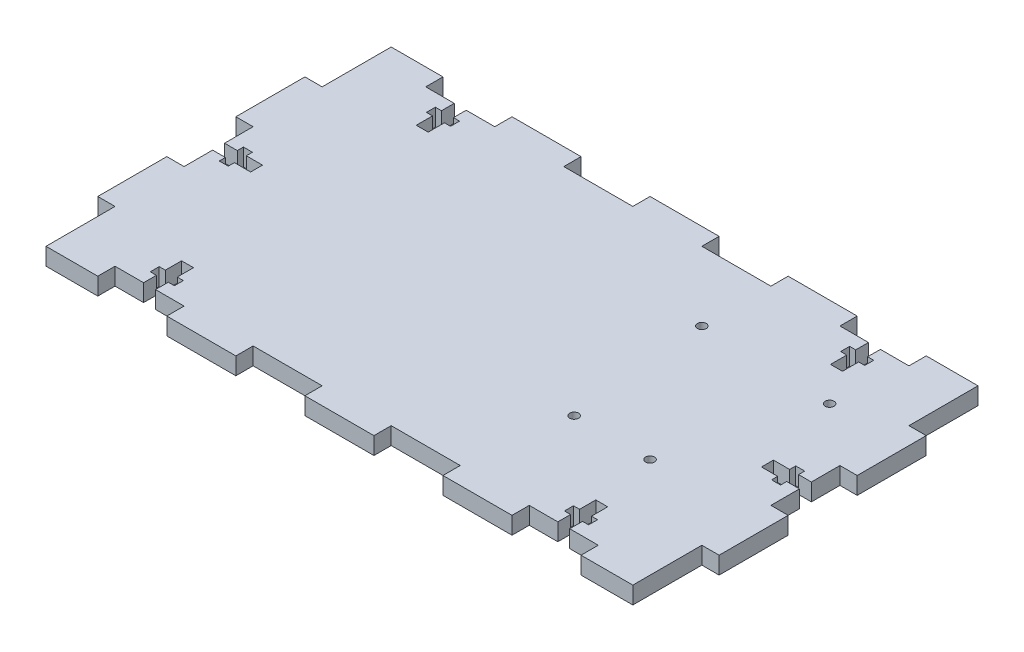
from build123d import *

# Parameters (mm, degrees)
SKETCH1_W                 = 228.6
SKETCH1_H                 = 127
BOSS_EXTRUDE1_DEPTH       = 6.35
SKETCH2_W                 = 6.35
SKETCH2_H                 = 25.4
CUT_EXTRUDE1_DEPTH        = 6.35
LPATTERN1_COUNT           = 3
LPATTERN1_PITCH           = 50.8
LPATTERN1_COUNT_DIR2      = 2
LPATTERN1_PITCH_DIR2      = 222.25
SKETCH3_W                 = 25.4
SKETCH3_H                 = 6.35
CUT_EXTRUDE2_DEPTH        = 6.35
LPATTERN2_COUNT           = 4
LPATTERN2_PITCH           = 50.8
LPATTERN2_COUNT_DIR2      = 2
LPATTERN2_PITCH_DIR2      = 120.65
SKETCH4_W                 = 13.97
SKETCH4_H                 = 4.3942
SKETCH4_W_2               = 3.302
SKETCH4_H_2               = 8.89
CUT_EXTRUDE3_DEPTH        = 8.89
SKETCH5_W                 = 4.3942
SKETCH5_H                 = 13.97
SKETCH5_W_2               = 8.89
SKETCH5_H_2               = 3.302
CUT_EXTRUDE4_DEPTH        = 30.48
MIRROR3_COPY_1_SKETCH_W   = 4.3942
MIRROR3_COPY_1_SKETCH_H   = 13.97
MIRROR3_COPY_1_SKETCH_W_2 = 8.89
MIRROR3_COPY_1_SKETCH_H_2 = 3.302
MIRROR3_COPY_1_DEPTH      = 30.48
MIRROR3_COPY_2_SKETCH_W   = 4.3942
MIRROR3_COPY_2_SKETCH_H   = 13.97
MIRROR3_COPY_2_SKETCH_W_2 = 8.89
MIRROR3_COPY_2_SKETCH_H_2 = 3.302
MIRROR3_COPY_2_DEPTH      = 30.48
F_4_CLEARANCE_HOLE1_D     = 3.2639
F_4_CLEARANCE_HOLE1_DEPTH = 10.16
F_4_CLEARANCE_HOLE1_TIP   = 0.980574487


with BuildPart() as part:
    # Sketch1 → Boss-Extrude1 (new body)
    with BuildSketch(Plane(origin=(0, 0, 0), x_dir=(1, 0, 0), z_dir=(0, 1, 0))):
        with Locations((114.3, 63.5)):
            Rectangle(SKETCH1_W, SKETCH1_H)
    extrude(amount=BOSS_EXTRUDE1_DEPTH)

    # Sketch2 → Cut-Extrude1 (cut)
    with BuildSketch(Plane(origin=(0, 6.35, 0), x_dir=(1, 0, 0), z_dir=(0, 1, 0))):
        with Locations((3.175, 114.3)):
            Rectangle(SKETCH2_W, SKETCH2_H)
    cut_extrude1 = extrude(amount=-CUT_EXTRUDE1_DEPTH, mode=Mode.SUBTRACT)

    # LPattern1: Cut-Extrude1 3 × 2
    with Locations(*[(j * LPATTERN1_PITCH_DIR2, 0, i * LPATTERN1_PITCH) for i in range(LPATTERN1_COUNT) for j in range(LPATTERN1_COUNT_DIR2) if (i, j) != (0, 0)]):
        add(cut_extrude1, mode=Mode.SUBTRACT)

    # Sketch3 → Cut-Extrude2 (cut)
    with BuildSketch(Plane(origin=(0, 6.35, 0), x_dir=(1, 0, 0), z_dir=(0, 1, 0))):
        with Locations((38.1, 3.175)):
            Rectangle(SKETCH3_W, SKETCH3_H)
    cut_extrude2 = extrude(amount=-CUT_EXTRUDE2_DEPTH, mode=Mode.SUBTRACT)

    # LPattern2: Cut-Extrude2 4 × 2
    with Locations(*[(i * LPATTERN2_PITCH, 0, -j * LPATTERN2_PITCH_DIR2) for i in range(LPATTERN2_COUNT) for j in range(LPATTERN2_COUNT_DIR2) if (i, j) != (0, 0)]):
        add(cut_extrude2, mode=Mode.SUBTRACT)

    # Sketch4 → Cut-Extrude3 (cut)
    with BuildSketch(Plane(origin=(0, 6.35, 0), x_dir=(1, 0, 0), z_dir=(0, 1, 0))):
        with Locations((215.265, 63.5)):
            Rectangle(SKETCH4_W, SKETCH4_H)
        with Locations((215.9, 63.5)):
            Rectangle(SKETCH4_W_2, SKETCH4_H_2)
    cut_extrude3 = extrude(amount=-CUT_EXTRUDE3_DEPTH, mode=Mode.SUBTRACT)

    # Mirror1: Cut-Extrude3 across plane
    add(cut_extrude3.mirror(Plane(origin=(114.3, 0, 0), x_dir=(0, 0, 1), z_dir=(1, 0, 0))), mode=Mode.SUBTRACT)

    # Sketch5 → Cut-Extrude4 (cut)
    with BuildSketch(Plane(origin=(0, 6.35, 0), x_dir=(1, 0, 0), z_dir=(0, 1, 0))):
        with Locations((38.1, 13.335)):
            Rectangle(SKETCH5_W, SKETCH5_H)
        with Locations((38.1, 12.7)):
            Rectangle(SKETCH5_W_2, SKETCH5_H_2)
    cut_extrude4 = extrude(amount=-CUT_EXTRUDE4_DEPTH, mode=Mode.SUBTRACT)

    # Mirror2: Cut-Extrude4 across plane
    add(cut_extrude4.mirror(Plane(origin=(114.3, 0, 0), x_dir=(0, 0, 1), z_dir=(1, 0, 0))), mode=Mode.SUBTRACT)

    # Mirror3 copy 1 sketch → Mirror3 copy 1 (cut)
    with BuildSketch(Plane(origin=(228.6, 6.35, -127), x_dir=(-1, 0, 0), z_dir=(0, 1, 0))):
        with Locations((38.1, 13.335)):
            Rectangle(MIRROR3_COPY_1_SKETCH_W, MIRROR3_COPY_1_SKETCH_H)
        with Locations((38.1, 12.7)):
            Rectangle(MIRROR3_COPY_1_SKETCH_W_2, MIRROR3_COPY_1_SKETCH_H_2)
    extrude(amount=-MIRROR3_COPY_1_DEPTH, mode=Mode.SUBTRACT)

    # Mirror3 copy 2 sketch → Mirror3 copy 2 (cut)
    with BuildSketch(Plane(origin=(0, 6.35, -127), x_dir=(1, 0, 0), z_dir=(0, 1, 0))):
        with Locations((38.1, -13.335)):
            Rectangle(MIRROR3_COPY_2_SKETCH_W, MIRROR3_COPY_2_SKETCH_H)
        with Locations((38.1, -12.7)):
            Rectangle(MIRROR3_COPY_2_SKETCH_W_2, MIRROR3_COPY_2_SKETCH_H_2)
    extrude(amount=-MIRROR3_COPY_2_DEPTH, mode=Mode.SUBTRACT)

    # #4 Clearance Hole1
    with Locations(Plane(origin=(0, 6.35, 0), x_dir=(1, 0, 0), z_dir=(0, 1, 0))):
        with Locations((152.4, 95.25), (200.66, 93.98), (185.42, 43.18), (157.48, 43.18)):
            Hole(F_4_CLEARANCE_HOLE1_D / 2, depth=F_4_CLEARANCE_HOLE1_DEPTH)
            with Locations((0, 0, -(F_4_CLEARANCE_HOLE1_DEPTH + F_4_CLEARANCE_HOLE1_TIP / 2))):  # 118° drill point
                Cone(0, F_4_CLEARANCE_HOLE1_D / 2, F_4_CLEARANCE_HOLE1_TIP, mode=Mode.SUBTRACT)


solid = part.part
